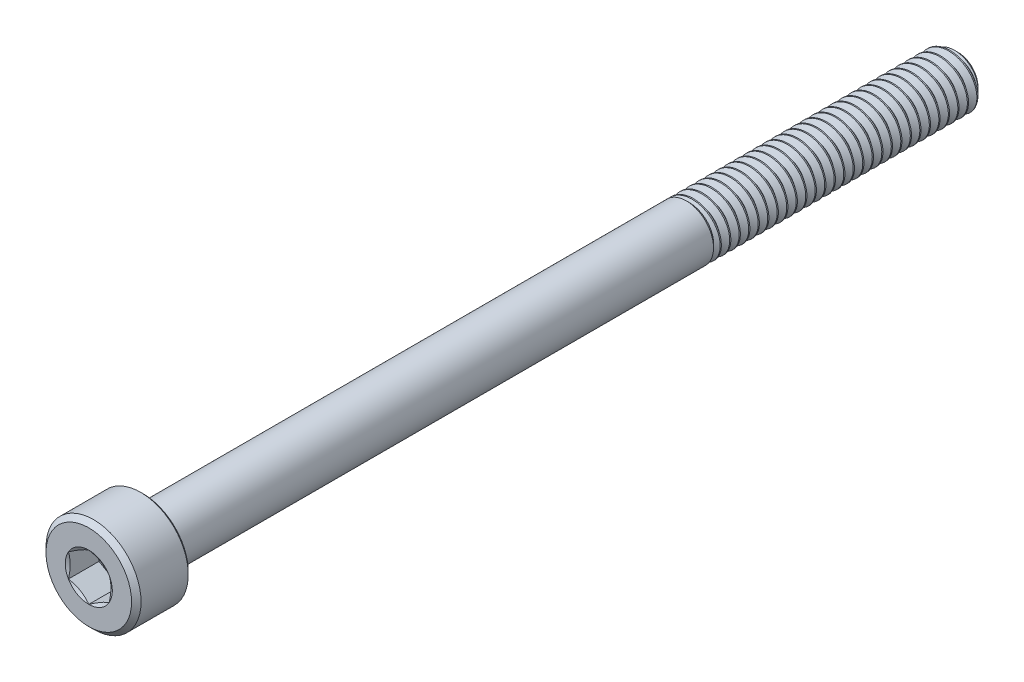
from build123d import *

# Parameters (mm, degrees)
CUT_EXTRUDE1_DEPTH            = 2.25
CHAMFER1_SIZE                 = 0.35
CHAMFER2_SIZE                 = 0.175
CUT_SWEEP1_PITCH              = 0.7
SKETCH9_R                     = 3.325
BOSS_EXTRUDE2_DEPTH           = 1.75
BOSS_EXTRUDE1_START           = 40
SKETCH8_R                     = 2
BOSS_EXTRUDE1_DEPTH           = 41.75
BOSS_EXTRUDE1_OTHER_WAY_DEPTH = 0.7
BOSS_EXTRUDE1_OTHER_WAY_TAPER = 45


with BuildPart() as part:
    # Sketch2 → Revolve1 (revolve)
    with BuildSketch(Plane(origin=(0, 0, 0), x_dir=(0, 0, -1), z_dir=(1, 0, 0)), mode=Mode.PRIVATE) as revolve1_sk:
        Polygon((32, 1.475), (31.475, 2), (-28, 2), (-28, 3.5), (-32, 3.5), (-32, 0), (32, 0), align=None)
    revolve(revolve1_sk.sketch.rotate(Axis((0, 0, -32), (0, 0, 1)), 90), axis=Axis((0, 0, -32), (0, 0, 1)))

    # Sketch4 → Cut-Extrude1 (cut)
    with BuildSketch(Plane.XY.offset(32)):
        Polygon((0, 1.732050808), (-1.5, 0.866025404), (-1.5, -0.866025404), (0, -1.732050808), (1.5, -0.866025404), (1.5, 0.866025404), align=None)
    extrude(amount=-CUT_EXTRUDE1_DEPTH, mode=Mode.SUBTRACT)

    # Cut-Extrude2 cone 1 section (through the dimple's axis) → Cut-Extrude2 (revolve, cut)
    with BuildSketch(Plane(origin=(0, 0, 32), x_dir=(0, -1, 0), z_dir=(1, 0, 0))):
        Polygon((0, 0), (1.732050808, 0), (0, 1), align=None)
    revolve(axis=Axis((0, 0, 32), (0, 0, -1)), mode=Mode.SUBTRACT)

    # Chamfer1
    chamfer1_edges = [part.edges().sort_by_distance(p)[0] for p in [
        (3.5, 0, 32),
    ]]
    chamfer(chamfer1_edges, length=CHAMFER1_SIZE)

    # Chamfer2
    chamfer2_edges = [part.edges().sort_by_distance(p)[0] for p in [
        (3.5, 0, 28),
    ]]
    chamfer(chamfer2_edges, length=CHAMFER2_SIZE)

    # Cut-Sweep1: the profile of Sketch7 screwed along a right-hand helix of 29.571429 turns, 6 arcs to a turn; built about Z, then put on its axis
    cut_sweep1_z = Axis((0, 0, 0), (0, 0, 1))
    cut_sweep1_corners = [(1.545336663, 0, -0.2625), (1.545336663, 0, -0.35), (2.037888611, 0, -0.634375), (2.037888611, 0, 0.021875)]
    with BuildLine(mode=Mode.PRIVATE) as cut_sweep1_profile:
        Line(cut_sweep1_corners[0], cut_sweep1_corners[1])
        Line(cut_sweep1_corners[1], cut_sweep1_corners[2])
        Line(cut_sweep1_corners[2], cut_sweep1_corners[3])
        Line(cut_sweep1_corners[3], cut_sweep1_corners[0])
    cut_sweep1_cap = Face(cut_sweep1_profile.wire())
    cut_sweep1_turn_angles = [0, 30, 60, 90, 120, 150, 180, 210, 240, 270, 300, 330, 360]
    cut_sweep1_turn_weights = [1, 0.8660254037844387, 1, 0.8660254037844387, 1, 0.8660254037844387, 1, 0.8660254037844387, 1, 0.8660254037844387, 1, 0.8660254037844387, 1]
    cut_sweep1_turn_rails = [Edge.make_bspline([Vector(p[0], p[1], 0).rotate(cut_sweep1_z, cut_sweep1_turn_angles[k]) / cut_sweep1_turn_weights[k] + Vector(0, 0, p[2] + CUT_SWEEP1_PITCH * cut_sweep1_turn_angles[k] / 360) for k in range(13)], [0, 0, 0, 1, 1, 2, 2, 3, 3, 4, 4, 5, 5, 6, 6, 6], 2, cut_sweep1_turn_weights) for p in cut_sweep1_corners]
    cut_sweep1_turn_sides = [Face.make_surface_from_curves(cut_sweep1_turn_rails[p[0]], cut_sweep1_turn_rails[p[1]]) for p in [(0, 1), (1, 2), (2, 3), (3, 0)]]
    cut_sweep1_last_angles = [10440, 10470, 10500, 10530, 10560, 10590, 10620, 10632.857142857, 10645.714285714]
    cut_sweep1_last_weights = [1, 0.8660254037844387, 1, 0.8660254037844387, 1, 0.8660254037844387, 1, 0.9749279121817342, 1]
    cut_sweep1_last_rails = [Edge.make_bspline([Vector(p[0], p[1], 0).rotate(cut_sweep1_z, cut_sweep1_last_angles[k]) / cut_sweep1_last_weights[k] + Vector(0, 0, p[2] + CUT_SWEEP1_PITCH * cut_sweep1_last_angles[k] / 360) for k in range(9)], [0, 0, 0, 1, 1, 2, 2, 3, 3, 4, 4, 4], 2, cut_sweep1_last_weights) for p in cut_sweep1_corners]
    cut_sweep1_last_sides = [Face.make_surface_from_curves(cut_sweep1_last_rails[p[0]], cut_sweep1_last_rails[p[1]]) for p in [(0, 1), (1, 2), (2, 3), (3, 0)]]
    cut_sweep1 = Plane(origin=(0, 0, -32), x_dir=(0, 1, 0), z_dir=(0, 0, 1)) * Solid(Shell([*[p.moved(Location((0, 0, CUT_SWEEP1_PITCH * i))) for i in range(29) for p in cut_sweep1_turn_sides], *cut_sweep1_last_sides, cut_sweep1_cap, cut_sweep1_cap.rotate(cut_sweep1_z, 10645.714285714).moved(Location((0, 0, CUT_SWEEP1_PITCH * 10645.714285714 / 360)))]))
    add(cut_sweep1, mode=Mode.SUBTRACT)

    # Sketch9 → Boss-Extrude2 (add)
    with BuildSketch(Plane(origin=(0, 0, 28), x_dir=(-1, 0, 0), z_dir=(0, 0, -1))):
        Circle(SKETCH9_R)
    extrude(amount=-BOSS_EXTRUDE2_DEPTH)

    # Sketch8 → Boss-Extrude1 (add)
    with BuildSketch(Plane(origin=(0, 0, 28), x_dir=(-1, 0, 0), z_dir=(0, 0, -1)).offset(BOSS_EXTRUDE1_START)):
        Circle(SKETCH8_R)
    extrude(amount=-BOSS_EXTRUDE1_DEPTH)

    # Sketch8 → Boss-Extrude1 other way (add)
    with BuildSketch(Plane(origin=(0, 0, 28), x_dir=(-1, 0, 0), z_dir=(0, 0, -1)).offset(BOSS_EXTRUDE1_START)):
        Circle(SKETCH8_R)
    extrude(amount=BOSS_EXTRUDE1_OTHER_WAY_DEPTH, taper=BOSS_EXTRUDE1_OTHER_WAY_TAPER)


solid = part.part
